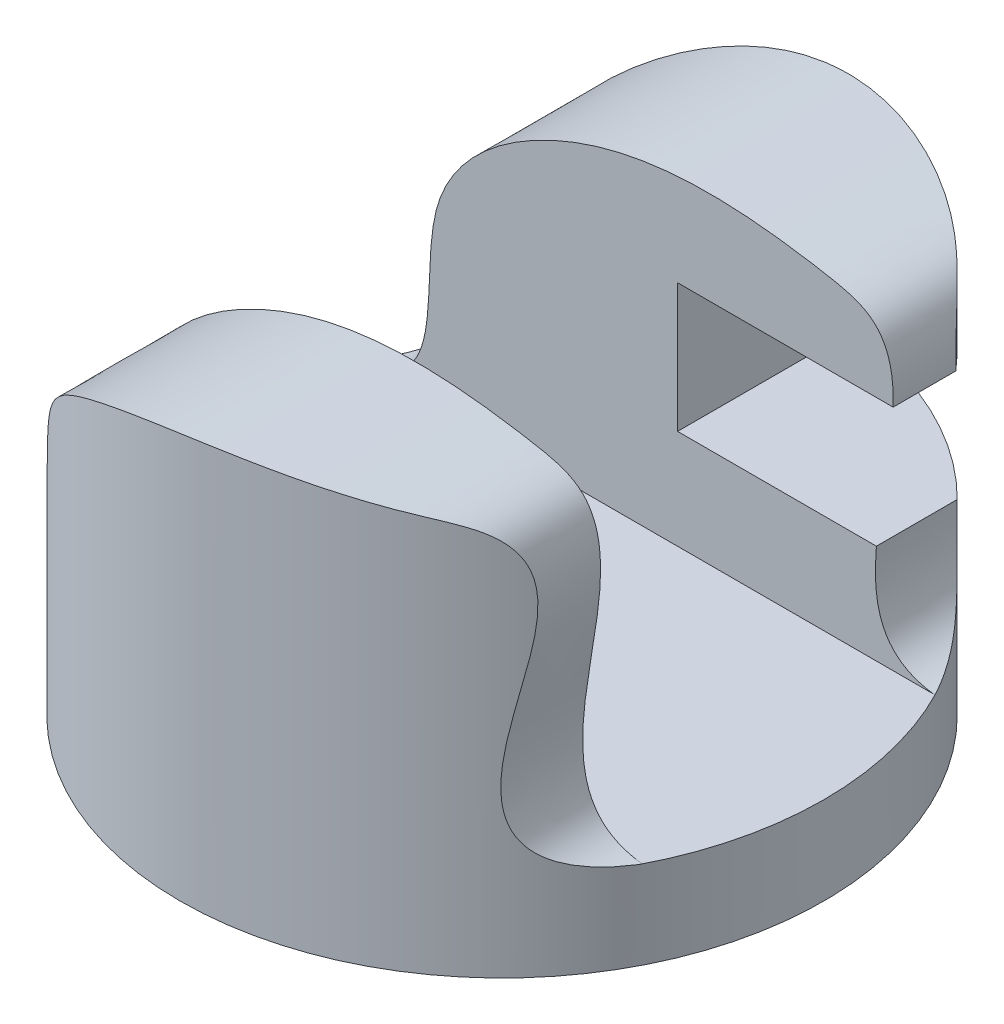
from build123d import *

# Parameters (mm, degrees)
SKETCH1_R               = 55
BOSS_EXTRUDE1_DEPTH     = 80
CUT_EXTRUDE2_START      = 15
SKETCH5_W               = 110.681439108
SKETCH5_H               = 50
CUT_EXTRUDE2_DEPTH      = 85
CUT_EXTRUDE1_DEPTH      = 112.579568022
CUT_EXTRUDE1_DEPTH_BACK = 112.579568022
SKETCH6_R               = 11.2
CUT_EXTRUDE3_DEPTH      = 8
SKETCH7_W               = 41.211758071
SKETCH7_H               = 22
CUT_EXTRUDE4_DEPTH      = 48


with BuildPart() as part:
    # Sketch1 → Boss-Extrude1 (new body)
    with BuildSketch(Plane(origin=(0, 0, 0), x_dir=(1, 0, 0), z_dir=(0, 1, 0))):
        Circle(SKETCH1_R)
    extrude(amount=BOSS_EXTRUDE1_DEPTH)

    # Sketch5 → Cut-Extrude2 (cut)
    with BuildSketch(Plane(origin=(0, 0, 0), x_dir=(1, 0, 0), z_dir=(0, 1, 0)).offset(CUT_EXTRUDE2_START)):
        Rectangle(SKETCH5_W, SKETCH5_H)
    extrude(amount=CUT_EXTRUDE2_DEPTH, mode=Mode.SUBTRACT)

    # Sketch4 → Cut-Extrude1 (cut, two sides: drawn at the far end of the back side and taken through both)
    with BuildSketch(Plane.XY.offset(-CUT_EXTRUDE1_DEPTH_BACK)):
        with BuildLine():
            Line((-94.828209873, 60.452504181), (-55, 15))
            Line((-55, 15), (-49.684237884, 15))
            add(Edge.make_bspline(
                [(-49.684237884, 15), (-33.07551205, 16.468583848), (-44.680202692, 45.845621611), (-10.258695524, 71.390258982), (16.658809544, 70.731741877), (55.128662603, 63.018743745), (25.766987996, 17.967779307), (48.800389023, 15)],
                knots=[0.019040261, 0.019040261, 0.019040261, 0.019040261, 0.221887337, 0.380111626, 0.626065957, 0.665786309, 0.976213102, 0.976213102, 0.976213102, 0.976213102], degree=3))
            Line((48.800389023, 15), (55, 15))
            Line((55, 15), (71.585022966, 38.144195373))
            Line((71.585022966, 38.144195373), (65.610002619, 86.178672673))
            Line((65.610002619, 86.178672673), (-52.265595306, 84.773998219))
            Line((-52.265595306, 84.773998219), (-94.828209873, 60.452504181))
        make_face()
    extrude(amount=CUT_EXTRUDE1_DEPTH + CUT_EXTRUDE1_DEPTH_BACK, mode=Mode.SUBTRACT)

    # Sketch6 → Cut-Extrude3 (cut)
    with BuildSketch(Plane(origin=(0, 0, 25), x_dir=(-1, 0, 0), z_dir=(0, 0, -1))):
        with Locations((-18, 43)):
            Circle(SKETCH6_R)
    extrude(amount=-CUT_EXTRUDE3_DEPTH, mode=Mode.SUBTRACT)

    # Sketch7 → Cut-Extrude4 (cut)
    with BuildSketch(Plane.XY.offset(-25)):
        with Locations((25.605879036, 43)):
            Rectangle(SKETCH7_W, SKETCH7_H)
    extrude(amount=-CUT_EXTRUDE4_DEPTH, mode=Mode.SUBTRACT)


solid = part.part
